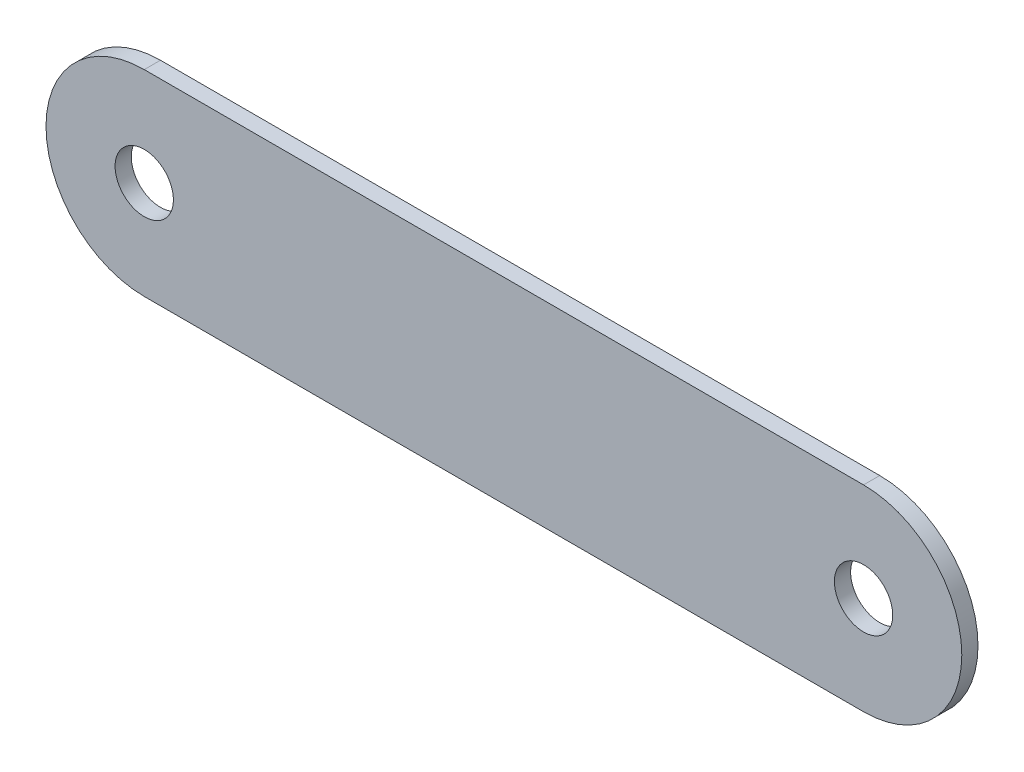
from build123d import *

# Parameters (mm, degrees)
SKETCH1_R           = 5.4
BOSS_EXTRUDE1_DEPTH = 3


with BuildPart() as part:
    # Sketch1 → Boss-Extrude1 (new body)
    with BuildSketch(Plane.XY):
        with BuildLine():
            Line((-66.6, 18.193025217), (66.6, 18.193025217))
            ThreePointArc((66.6, 18.193025217), (84.793025217, 0), (66.6, -18.193025217))
            Line((66.6, -18.193025217), (-66.6, -18.193025217))
            ThreePointArc((-66.6, -18.193025217), (-84.793025217, 0), (-66.6, 18.193025217))
        make_face()
        with Locations((-66.6, 0)):
            Circle(SKETCH1_R, mode=Mode.SUBTRACT)
        with Locations((66.6, 0)):
            Circle(SKETCH1_R, mode=Mode.SUBTRACT)
    extrude(amount=BOSS_EXTRUDE1_DEPTH)


solid = part.part
